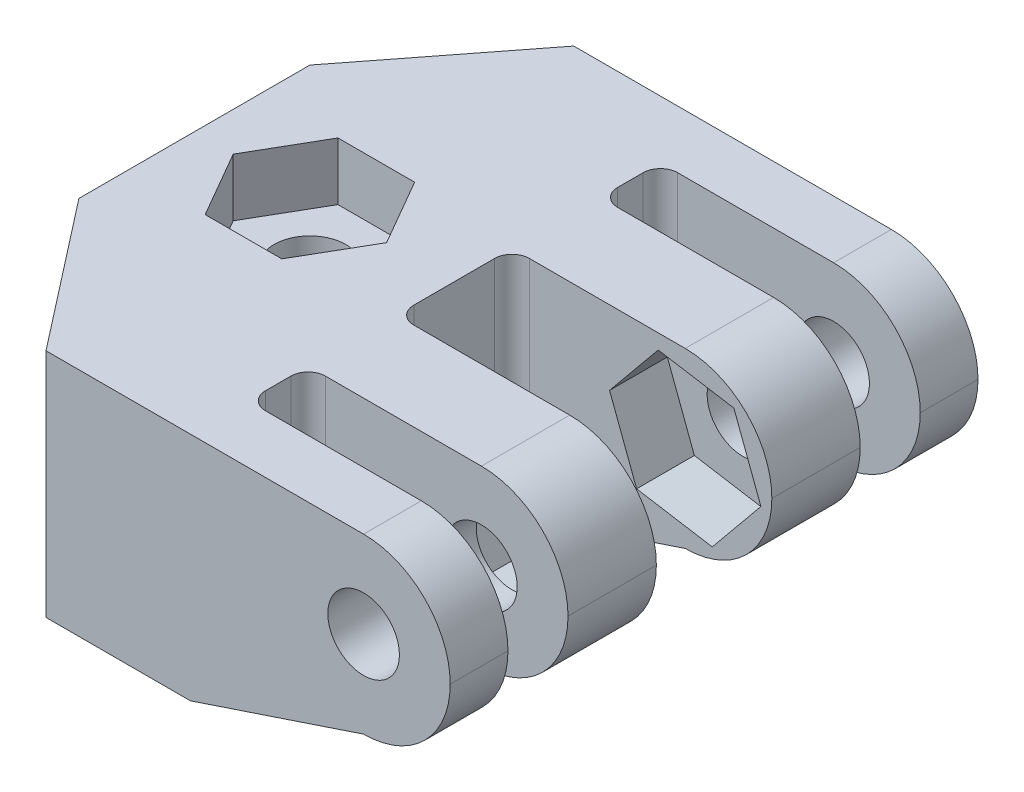
from build123d import *
from OCP.BRepFilletAPI import BRepFilletAPI_MakeChamfer

# Parameters (mm, degrees)
BOSS_EXTRUDE1_DEPTH = 15
CUT_EXTRUDE4_DEPTH  = 5
SKETCH7_R           = 3.1
CUT_EXTRUDE6_DEPTH  = 66.86721491
FILLET1_R           = 7.5
CUT_EXTRUDE7_DEPTH  = 5
CUT_EXTRUDE8_DEPTH  = 5
FILLET2_R           = 1.5
BOSS_EXTRUDE2_DEPTH = 5
SKETCH6_R           = 3.1
CUT_EXTRUDE5_DEPTH  = 66.86721491
CHAMFER8_SIZE       = 15
CHAMFER8_SIZE_2     = 5


with BuildPart() as part:
    # Sketch1 → Boss-Extrude1 (new body)
    with BuildSketch(Plane(origin=(0, 0, 0), x_dir=(1, 0, 0), z_dir=(0, 1, 0))):
        Polygon((0, 0), (-35, 0), (-45, 12.85), (-45, 32.85), (-35, 45.7), (0, 45.7), (0, 40.7), (-22.5, 40.7), (-22.5, 35.5), (0, 35.5), (0, 27.85), (-22.5, 27.85), (-22.5, 17.85), (0, 17.85), (0, 10.2), (-22.5, 10.2), (-22.5, 5), (0, 5), align=None)
    extrude(amount=BOSS_EXTRUDE1_DEPTH)

    # Sketch5 → Cut-Extrude4 (cut)
    with BuildSketch(Plane(origin=(0, 15, 0), x_dir=(1, 0, 0), z_dir=(0, 1, 0))):
        Polygon((-41.639528096, 22.85), (-38.319764048, 17.1), (-31.680235952, 17.1), (-28.360471904, 22.85), (-31.680235952, 28.6), (-38.319764048, 28.6), align=None)
    extrude(amount=-CUT_EXTRUDE4_DEPTH, mode=Mode.SUBTRACT)

    # Sketch7 → Cut-Extrude6 (cut, through all)
    with BuildSketch(Plane.XY):
        with Locations((-7.5, 7.5)):
            Circle(SKETCH7_R)
    extrude(amount=-CUT_EXTRUDE6_DEPTH, mode=Mode.SUBTRACT)

    # Fillet1
    fillet1_edges = [part.edges().sort_by_distance(p)[0] for p in [
        (0, 0, -43.2),
        (0, 0, -31.675),
        (0, 0, -2.5),
        (0, 15, -43.2),
        (0, 15, -31.675),
        (0, 15, -2.5),
        (0, 0, -14.025),
        (0, 15, -14.025),
    ]]
    fillet(fillet1_edges, radius=FILLET1_R - 0.0001)  # a hair under: the kernel refuses the full size

    # Sketch8 → Cut-Extrude7 (cut)
    with BuildSketch(Plane.XY.offset(-27.85)):
        Polygon((-9.839641819, 13.713647036), (-14.050997093, 8.580634267), (-11.711355274, 2.366987231), (-5.160358181, 1.286352964), (-0.949002907, 6.419365733), (-3.288644726, 12.633012769), align=None)
    extrude(amount=-CUT_EXTRUDE7_DEPTH, mode=Mode.SUBTRACT)

    # Sketch9 → Cut-Extrude8 (cut)
    with BuildSketch(Plane(origin=(0, 0, -17.85), x_dir=(-1, 0, 0), z_dir=(0, 0, -1))):
        Polygon((9.839641819, 13.713647036), (3.288644726, 12.633012769), (0.949002907, 6.419365733), (5.160358181, 1.286352964), (11.711355274, 2.366987231), (14.050997093, 8.580634267), align=None)
    extrude(amount=-CUT_EXTRUDE8_DEPTH, mode=Mode.SUBTRACT)

    # Fillet2
    fillet2_edges = [part.edges().sort_by_distance(p)[0] for p in [
        (-22.5, 7.5, -40.7),
        (-22.5, 7.5, -35.5),
        (-22.5, 7.5, -27.85),
        (-22.5, 7.5, -17.85),
        (-22.5, 7.5, -10.2),
        (-22.5, 7.5, -5),
    ]]
    fillet(fillet2_edges, radius=FILLET2_R)

    # Sketch15 → Boss-Extrude2 (add)
    with BuildSketch(Plane.XZ):
        Polygon((-35, 0), (-45, -12.85), (-45, -32.85), (-35, -45.7), (-22.5, -45.7), (-22.5, 0), align=None)
    extrude(amount=BOSS_EXTRUDE2_DEPTH)

    # Sketch6 → Cut-Extrude5 (cut, through all)
    with BuildSketch(Plane(origin=(0, 10, 0), x_dir=(1, 0, 0), z_dir=(0, 1, 0))):
        with Locations(Location((-35, 22.85, 0), (0, 0, 270))):
            Circle(SKETCH6_R)
    extrude(amount=-CUT_EXTRUDE5_DEPTH, mode=Mode.SUBTRACT)

    # Chamfer8
    chamfer8_edges_1 = [part.edges().sort_by_distance(p)[0] for p in [
        (-22.5, 0, -3.25),
    ]]
    chamfer8_side_1 = [part.faces().sort_by_distance(p)[0] for p in [
        (-22.4, 0, -3.25),
    ]]
    chamfer8_edges_2 = [part.edges().sort_by_distance(p)[0] for p in [
        (-22.5, 0, -42.45),
    ]]
    chamfer8_side_2 = [part.faces().sort_by_distance(p)[0] for p in [
        (-22.5, -0.1, -42.45),
    ]]
    chamfer8_edges_3 = [part.edges().sort_by_distance(p)[0] for p in [
        (-22.5, 0, -14.025),
    ]]
    chamfer8_side_3 = [part.faces().sort_by_distance(p)[0] for p in [
        (-22.5, -0.1, -14.025),
    ]]
    chamfer8_edges_4 = [part.edges().sort_by_distance(p)[0] for p in [
        (-22.5, 0, -31.675),
    ]]
    chamfer8_side_4 = [part.faces().sort_by_distance(p)[0] for p in [
        (-22.5, -0.1, -31.675),
    ]]
    chamfer8 = BRepFilletAPI_MakeChamfer(part.part.solid().wrapped)
    for e in chamfer8_edges_1:
        chamfer8.Add(CHAMFER8_SIZE - 0.0001, CHAMFER8_SIZE_2 - 0.0001, e.wrapped, chamfer8_side_1[0].wrapped)
    for e in chamfer8_edges_2:
        chamfer8.Add(CHAMFER8_SIZE_2 - 0.0001, CHAMFER8_SIZE - 0.0001, e.wrapped, chamfer8_side_2[0].wrapped)
    for e in chamfer8_edges_3:
        chamfer8.Add(CHAMFER8_SIZE_2 - 0.0001, CHAMFER8_SIZE - 0.0001, e.wrapped, chamfer8_side_3[0].wrapped)
    for e in chamfer8_edges_4:
        chamfer8.Add(CHAMFER8_SIZE_2 - 0.0001, CHAMFER8_SIZE - 0.0001, e.wrapped, chamfer8_side_4[0].wrapped)
    add(Compound.cast(chamfer8.Shape()), mode=Mode.REPLACE)  # a hair under: the kernel refuses the full size


solid = part.part
